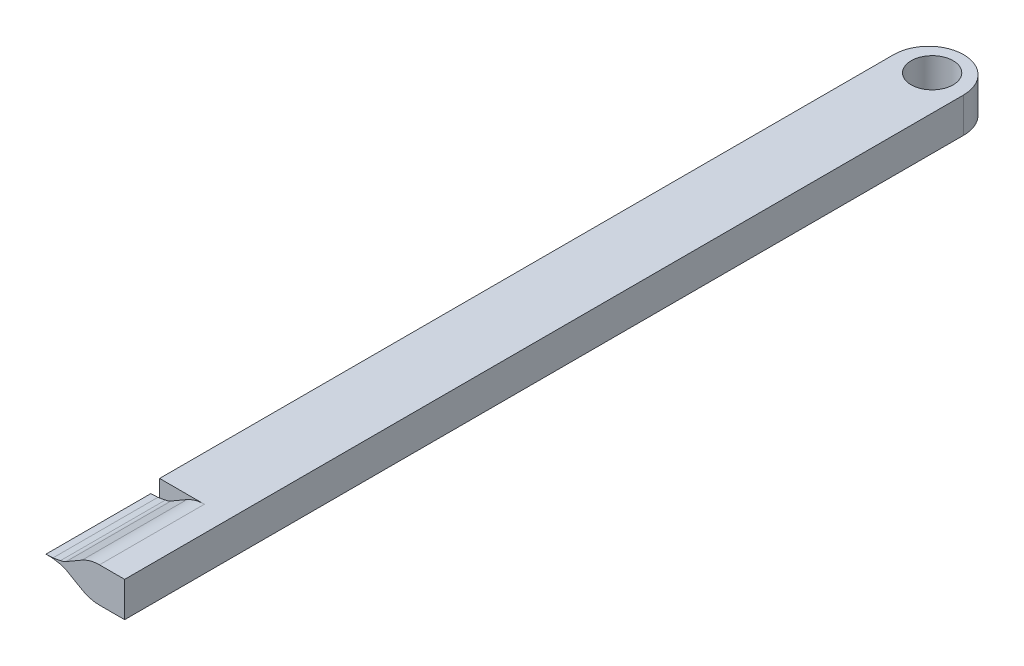
from build123d import *

# Parameters (mm, degrees)
SKETCH2_W           = 20
SKETCH2_H           = 10
BOSS_EXTRUDE1_DEPTH = 250
SKETCH3_R           = 6
CUT_EXTRUDE1_DEPTH  = 30
FILLET1_R           = 10
FILLET3_R           = 10
SKETCH4_W           = 30
SKETCH4_H           = 10
BOSS_EXTRUDE2_DEPTH = 2.5
CUT_EXTRUDE2_DEPTH  = 30
FILLET4_R           = 5
FILLET5_R           = 10


with BuildPart() as part:
    # Sketch2 → Boss-Extrude1 (new body)
    with BuildSketch(Plane.XY):
        with Locations((10, 5)):
            Rectangle(SKETCH2_W, SKETCH2_H)
    extrude(amount=BOSS_EXTRUDE1_DEPTH)

    # Sketch3 → Cut-Extrude1 (cut)
    with BuildSketch(Plane(origin=(0, 10, 0), x_dir=(1, 0, 0), z_dir=(0, 1, 0))):
        with Locations(Location((10, -9, 0), (0, 0, 270))):
            Circle(SKETCH3_R)
    extrude(amount=-CUT_EXTRUDE1_DEPTH, mode=Mode.SUBTRACT)

    # Fillet1
    fillet1_edges = [part.edges().sort_by_distance(p)[0] for p in [
        (20, 5, 0),
    ]]
    fillet(fillet1_edges, radius=FILLET1_R)

    # Fillet3
    fillet3_edges = [part.edges().sort_by_distance(p)[0] for p in [
        (0, 5, 0),
    ]]
    fillet(fillet3_edges, radius=FILLET3_R - 0.0001)  # a hair under: the kernel refuses the full size

    # Sketch4 → Boss-Extrude2 (add)
    with BuildSketch(Plane.ZY):
        with Locations((235, 5)):
            Rectangle(SKETCH4_W, SKETCH4_H)
    extrude(amount=BOSS_EXTRUDE2_DEPTH)

    # Sketch5 → Cut-Extrude2 (cut)
    with BuildSketch(Plane.XY.offset(250)):
        Polygon((-2.5, 10), (-2.5, 5), (-0.5, 5.069841539), (2.5, 5.598822481), (10.123063076, 10), align=None)
        Polygon((-0.5, 4.930158461), (-2.5, 5), (-2.5, 0), (10.123063076, 0), (2.5, 4.401177519), align=None)
    extrude(amount=-CUT_EXTRUDE2_DEPTH, mode=Mode.SUBTRACT)

    # Fillet4
    fillet4_edges = [part.edges().sort_by_distance(p)[0] for p in [
        (2.5, 5.598822481, 235),
        (2.5, 4.401177519, 235),
    ]]
    fillet(fillet4_edges, radius=FILLET4_R)

    # Fillet5
    fillet5_edges = [part.edges().sort_by_distance(p)[0] for p in [
        (10.123063076, 10, 235),
        (10.123063076, 0, 235),
    ]]
    fillet(fillet5_edges, radius=FILLET5_R)


solid = part.part
